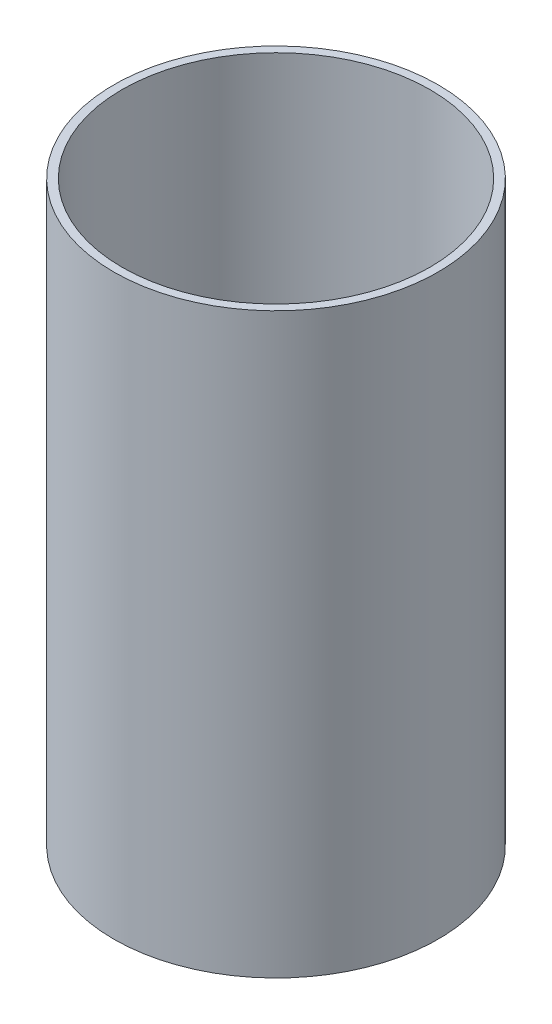
from build123d import *

# Parameters (mm, degrees)
SKETCH1_R           = 93.6625
SKETCH1_R_2         = 88.9
BOSS_EXTRUDE1_DEPTH = 166.84752


with BuildPart() as part:
    # Sketch1 → Boss-Extrude1 (new, symmetric)
    with BuildSketch(Plane(origin=(0, 0, 0), x_dir=(1, 0, 0), z_dir=(0, 1, 0))):
        Circle(SKETCH1_R)
        Circle(SKETCH1_R_2, mode=Mode.SUBTRACT)
    extrude(amount=BOSS_EXTRUDE1_DEPTH, both=True)


solid = part.part
